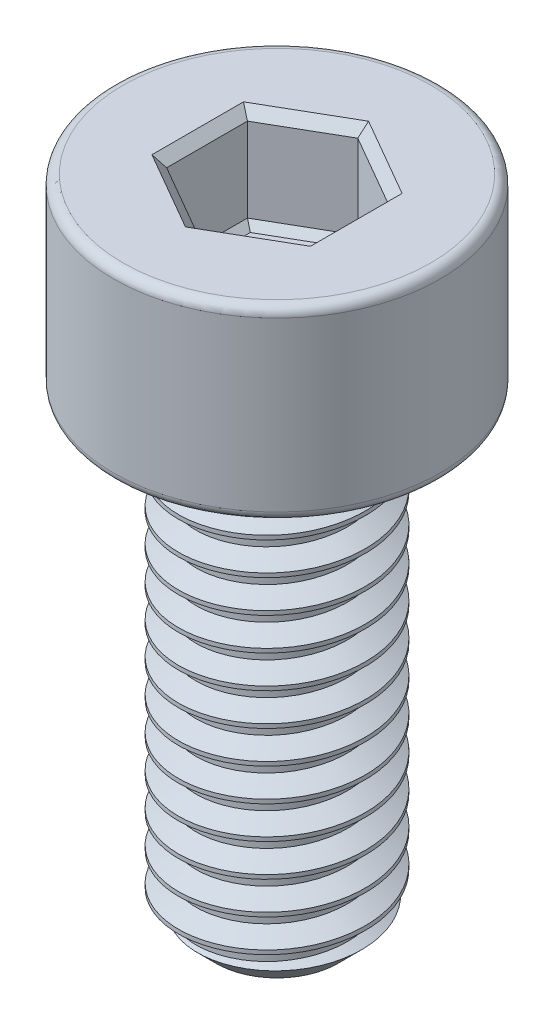
from build123d import *

# Parameters (mm, degrees)
SKETCH1_R           = 2
BOSS_EXTRUDE1_DEPTH = 10
THREAD1_PITCH       = 0.7
SKETCH4_R           = 3.5
BOSS_EXTRUDE2_DEPTH = 4
FILLET1_R           = 0.2
CUT_EXTRUDE1_DEPTH  = 2
CHAMFER1_SIZE       = 0.2
CUT_EXTRUDE2_DEPTH  = 0.15
CUT_EXTRUDE2_DRAFT  = -45


with BuildPart() as part:
    # Sketch1 → Boss-Extrude1 (new body)
    with BuildSketch(Plane(origin=(0, 0, 0), x_dir=(1, 0, 0), z_dir=(0, 1, 0))):
        with Locations(Location((0, 0, 0), (0, 0, 270))):
            Circle(SKETCH1_R)
    extrude(amount=BOSS_EXTRUDE1_DEPTH)

    # Thread1: arcs per turn and ends read off the stored shape
    # Thread1: the profile of Thread Profile1 profile screwed along a right-hand helix through 17.142853 turns, 6 arcs to a turn; built about Z, then put on its axis
    thread1_z = Axis((0, 0, 0), (0, 0, 1))
    thread1_corners = [(2.0003, 0, -0.000173205), (2.0003, 0, 0.612673203), (1.621113887, 0, 0.393749999), (1.621113887, 0, 0.218749999)]
    with BuildLine(mode=Mode.PRIVATE) as thread1_profile:
        Line(thread1_corners[0], thread1_corners[1])
        Line(thread1_corners[1], thread1_corners[2])
        Line(thread1_corners[2], thread1_corners[3])
        Line(thread1_corners[3], thread1_corners[0])
    thread1_cap = Face(thread1_profile.wire())
    thread1_turn_angles = [0, 30, 60, 90, 120, 150, 180, 210, 240, 270, 300, 330, 360]
    thread1_turn_weights = [1, 0.8660254037844387, 1, 0.8660254037844387, 1, 0.8660254037844387, 1, 0.8660254037844387, 1, 0.8660254037844387, 1, 0.8660254037844387, 1]
    thread1_turn_rails = [Edge.make_bspline([Vector(p[0], p[1], 0).rotate(thread1_z, thread1_turn_angles[k]) / thread1_turn_weights[k] + Vector(0, 0, p[2] + THREAD1_PITCH * thread1_turn_angles[k] / 360) for k in range(13)], [0, 0, 0, 1, 1, 2, 2, 3, 3, 4, 4, 5, 5, 6, 6, 6], 2, thread1_turn_weights) for p in thread1_corners]
    thread1_turn_sides = [Face.make_surface_from_curves(thread1_turn_rails[p[0]], thread1_turn_rails[p[1]]) for p in [(0, 1), (1, 2), (2, 3), (3, 0)]]
    thread1_last_angles = [6120, 6145.7135, 6171.427]
    thread1_last_weights = [1, 0.9009748177961333, 1]
    thread1_last_rails = [Edge.make_bspline([Vector(p[0], p[1], 0).rotate(thread1_z, thread1_last_angles[k]) / thread1_last_weights[k] + Vector(0, 0, p[2] + THREAD1_PITCH * thread1_last_angles[k] / 360) for k in range(3)], [0, 0, 0, 1, 1, 1], 2, thread1_last_weights) for p in thread1_corners]
    thread1_last_sides = [Face.make_surface_from_curves(thread1_last_rails[p[0]], thread1_last_rails[p[1]]) for p in [(0, 1), (1, 2), (2, 3), (3, 0)]]
    thread1 = Plane(origin=(0, -1, 0), x_dir=(1, 0, 0), z_dir=(0, 1, 0)) * Solid(Shell([*[p.moved(Location((0, 0, THREAD1_PITCH * i))) for i in range(17) for p in thread1_turn_sides], *thread1_last_sides, thread1_cap, thread1_cap.rotate(thread1_z, 6171.427).moved(Location((0, 0, THREAD1_PITCH * 6171.427 / 360)))]))
    add(thread1, mode=Mode.SUBTRACT)

    # Sketch4 → Boss-Extrude2 (add)
    with BuildSketch(Plane(origin=(0, 10, 0), x_dir=(-1, 0, 0), z_dir=(0, -1, 0))):
        with Locations(Location((0, 0, 0), (0, 0, 90))):
            Circle(SKETCH4_R)
    extrude(amount=-BOSS_EXTRUDE2_DEPTH)

    # Fillet1
    fillet1_edges = [part.edges().sort_by_distance(p)[0] for p in [
        (0, 10, 3.5),
        (0, 14, 3.5),
    ]]
    fillet(fillet1_edges, radius=FILLET1_R)

    # Sketch6 → Cut-Revolve1 (revolve, cut)
    with BuildSketch(Plane.XY, mode=Mode.PRIVATE) as cut_revolve1_sk:
        Polygon((2.01, 0), (2.01, 0.7), (1.31, 0), align=None)
    revolve(cut_revolve1_sk.sketch.rotate(Axis((0, 0, 0), (0, 1, 0)), 202.132599438), axis=Axis((0, 0, 0), (0, 1, 0)), mode=Mode.SUBTRACT)

    # Sketch7 → Cut-Extrude1 (cut)
    with BuildSketch(Plane(origin=(0, 14, 0), x_dir=(1, 0, 0), z_dir=(0, 1, 0))):
        Polygon((0, 1.732050808), (-1.5, 0.866025404), (-1.5, -0.866025404), (0, -1.732050808), (1.5, -0.866025404), (1.5, 0.866025404), align=None)
    extrude(amount=-CUT_EXTRUDE1_DEPTH, mode=Mode.SUBTRACT)

    # Chamfer1
    chamfer1_edges = [part.edges().sort_by_distance(p)[0] for p in [
        (0.75, 14, -1.299038106),
        (-0.75, 14, -1.299038106),
        (-1.5, 14, 0),
        (-0.75, 14, 1.299038106),
        (0.75, 14, 1.299038106),
        (1.5, 14, 0),
    ]]
    chamfer(chamfer1_edges, length=CHAMFER1_SIZE)


with BuildPart() as cut_extrude2_tool:
    # Sketch8 → Cut-Extrude2 (with draft: the straight prism first)
    with BuildSketch(Plane(origin=(0, 12, 0), x_dir=(1, 0, 0), z_dir=(0, 1, 0))):
        Polygon((0, 1.732050808), (-1.5, 0.866025404), (-1.5, -0.866025404), (0, -1.732050808), (1.5, -0.866025404), (1.5, 0.866025404), align=None)
    extrude(amount=-CUT_EXTRUDE2_DEPTH)
    # Cut-Extrude2: the draft: its side faces are tilted about the plane it starts from
    cut_extrude2_sides = [cut_extrude2_tool.faces().sort_by_distance(p)[0] for p in [
        (-0.75, 11.925, -1.299038106),
        (-1.5, 11.925, 0),
        (-0.75, 11.925, 1.299038106),
        (0.75, 11.925, 1.299038106),
        (1.5, 11.925, 0),
        (0.75, 11.925, -1.299038106),
    ]]
    draft(cut_extrude2_sides, Plane(origin=(0, 12, 0), x_dir=(1, 0, 0), z_dir=(0, 1, 0)), CUT_EXTRUDE2_DRAFT)


with BuildPart() as part_1:
    add(part.part)

    # Cut-Extrude2: cut by cut_extrude2_tool
    add(cut_extrude2_tool.part, mode=Mode.SUBTRACT)


solid = part_1.part
